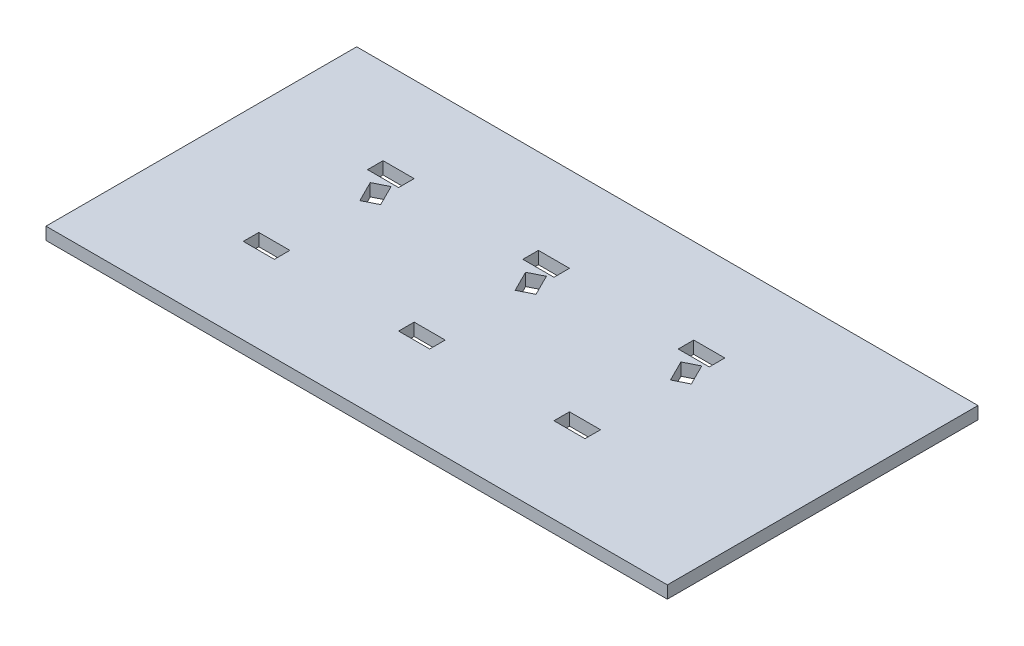
from build123d import *

# Parameters (mm, degrees)
SKETCH1_W                 = 101.6
SKETCH1_H                 = 50.8
BOSS_EXTRUDE1_DEPTH       = 2.032
CUT_EXTRUDE1_DEPTH        = 57.832464525
SKETCH3_W                 = 5.08
SKETCH3_H                 = 2.54
CUT_EXTRUDE2_DEPTH        = 57.832464525
LPATTERN1_COUNT           = 2
LPATTERN1_PITCH           = 25.4
LPATTERN1_COUNT_DIR2      = 2
LPATTERN1_PITCH_DIR2      = 25.4
LPATTERN1_COPY_1_SKETCH_W = 5.08
LPATTERN1_COPY_1_SKETCH_H = 2.54
LPATTERN1_COPY_1_DEPTH    = 57.832464525
LPATTERN1_COPY_2_SKETCH_W = 5.08
LPATTERN1_COPY_2_SKETCH_H = 2.54
LPATTERN1_COPY_2_DEPTH    = 57.832464525
LPATTERN1_COPY_3_SKETCH_W = 5.08
LPATTERN1_COPY_3_SKETCH_H = 2.54
LPATTERN1_COPY_3_DEPTH    = 57.832464525


with BuildPart() as part:
    # Sketch1 → Boss-Extrude1 (new body)
    with BuildSketch(Plane(origin=(0, 0, 0), x_dir=(1, 0, 0), z_dir=(0, 1, 0))):
        Rectangle(SKETCH1_W, SKETCH1_H)
    extrude(amount=BOSS_EXTRUDE1_DEPTH)

    # Sketch2 → Cut-Extrude1 (cut, through all)
    with BuildSketch(Plane(origin=(0, 2.032, 0), x_dir=(1, 0, 0), z_dir=(0, 1, 0))):
        Polygon((-5.061841618, 7.282181714), (-3.357663485, 3.874561299), (-1.085916542, 5.010680054), (-2.790094674, 8.418300469), align=None)
    cut_extrude1 = extrude(amount=-CUT_EXTRUDE1_DEPTH, mode=Mode.SUBTRACT)

    # Sketch3 → Cut-Extrude2 (cut, through all)
    with BuildSketch(Plane(origin=(0, 2.032, 0), x_dir=(1, 0, 0), z_dir=(0, 1, 0))):
        with Locations((-4.572, 10.16)):
            Rectangle(SKETCH3_W, SKETCH3_H)
    cut_extrude2 = extrude(amount=-CUT_EXTRUDE2_DEPTH, mode=Mode.SUBTRACT)

    # Mirror1: Cut-Extrude2 across plane
    add(cut_extrude2.mirror(Plane.XY), mode=Mode.SUBTRACT)

    # LPattern1: Cut-Extrude1, Cut-Extrude2 2 × 2
    with Locations(*[Vector(-1, 0, 0) * (i * LPATTERN1_PITCH) + Vector(1, 0, 0) * (j * LPATTERN1_PITCH_DIR2) for i in range(LPATTERN1_COUNT) for j in range(LPATTERN1_COUNT_DIR2) if (i, j) != (0, 0)]):
        add(cut_extrude1, mode=Mode.SUBTRACT)
        add(cut_extrude2, mode=Mode.SUBTRACT)

    # LPattern1 copy 1 sketch → LPattern1 copy 1 (cut, through all)
    with BuildSketch(Plane(origin=(25.4, 2.032, 0), x_dir=(1, 0, 0), z_dir=(0, 1, 0))):
        with Locations((-4.572, -10.16)):
            Rectangle(LPATTERN1_COPY_1_SKETCH_W, LPATTERN1_COPY_1_SKETCH_H)
    extrude(amount=-LPATTERN1_COPY_1_DEPTH, mode=Mode.SUBTRACT)

    # LPattern1 copy 2 sketch → LPattern1 copy 2 (cut, through all)
    with BuildSketch(Plane(origin=(-25.4, 2.032, 0), x_dir=(1, 0, 0), z_dir=(0, 1, 0))):
        with Locations((-4.572, -10.16)):
            Rectangle(LPATTERN1_COPY_2_SKETCH_W, LPATTERN1_COPY_2_SKETCH_H)
    extrude(amount=-LPATTERN1_COPY_2_DEPTH, mode=Mode.SUBTRACT)

    # LPattern1 copy 3 sketch → LPattern1 copy 3 (cut, through all)
    with BuildSketch(Plane(origin=(0, 2.032, 0), x_dir=(1, 0, 0), z_dir=(0, 1, 0))):
        with Locations((-4.572, -10.16)):
            Rectangle(LPATTERN1_COPY_3_SKETCH_W, LPATTERN1_COPY_3_SKETCH_H)
    extrude(amount=-LPATTERN1_COPY_3_DEPTH, mode=Mode.SUBTRACT)


solid = part.part
